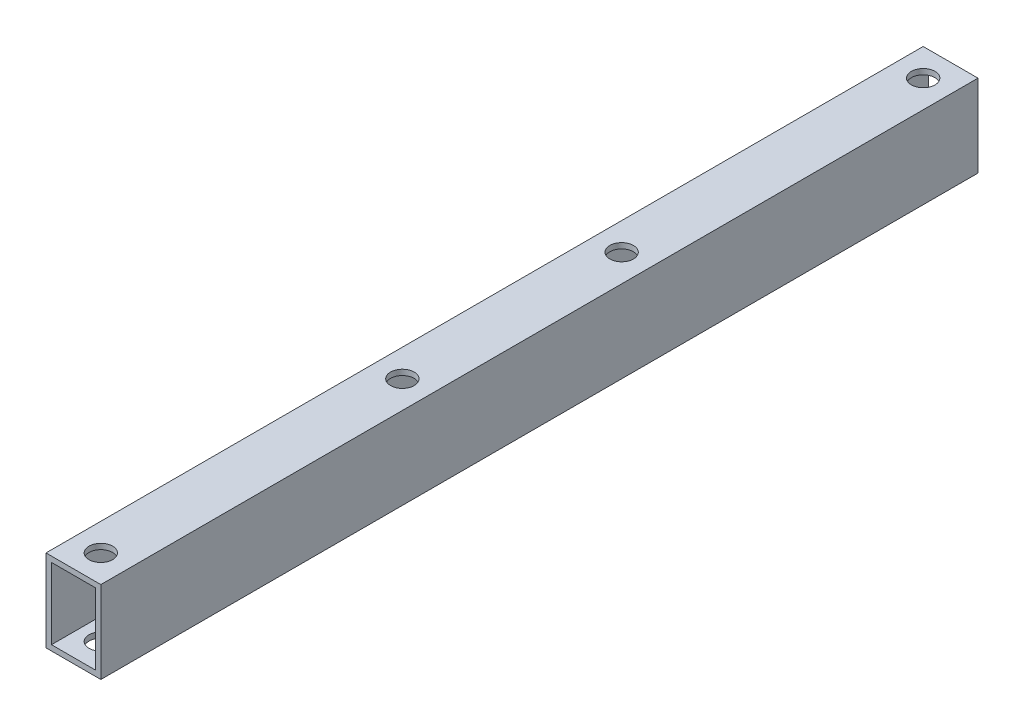
from build123d import *

# Parameters (mm, degrees)
SKETCH_1_W          = 10
SKETCH_1_H          = 15
SKETCH_1_W_2        = 8
SKETCH_1_H_2        = 13
EXTRUDE_1_DEPTH     = 160
SKETCH_2_R          = 2.15
CUT_EXTRUDE_1_DEPTH = 161.779351908


with BuildPart() as part:
    # ｽｹｯﾁ1 → 押し出し-薄板1 (new body)
    with BuildSketch(Plane.XY):
        Rectangle(SKETCH_1_W, SKETCH_1_H)
        Rectangle(SKETCH_1_W_2, SKETCH_1_H_2, mode=Mode.SUBTRACT)
    extrude(amount=EXTRUDE_1_DEPTH)

    # ｽｹｯﾁ2 → ｶｯﾄ - 押し出し1 (cut, through all)
    with BuildSketch(Plane(origin=(0, 7.5, 0), x_dir=(1, 0, 0), z_dir=(0, 1, 0))):
        with Locations((0, -60)):
            Circle(SKETCH_2_R)
        with Locations((0, -100)):
            Circle(SKETCH_2_R)
        with Locations((0, -5)):
            Circle(SKETCH_2_R)
        with Locations((0, -155)):
            Circle(SKETCH_2_R)
    extrude(amount=-CUT_EXTRUDE_1_DEPTH, mode=Mode.SUBTRACT)


solid = part.part
